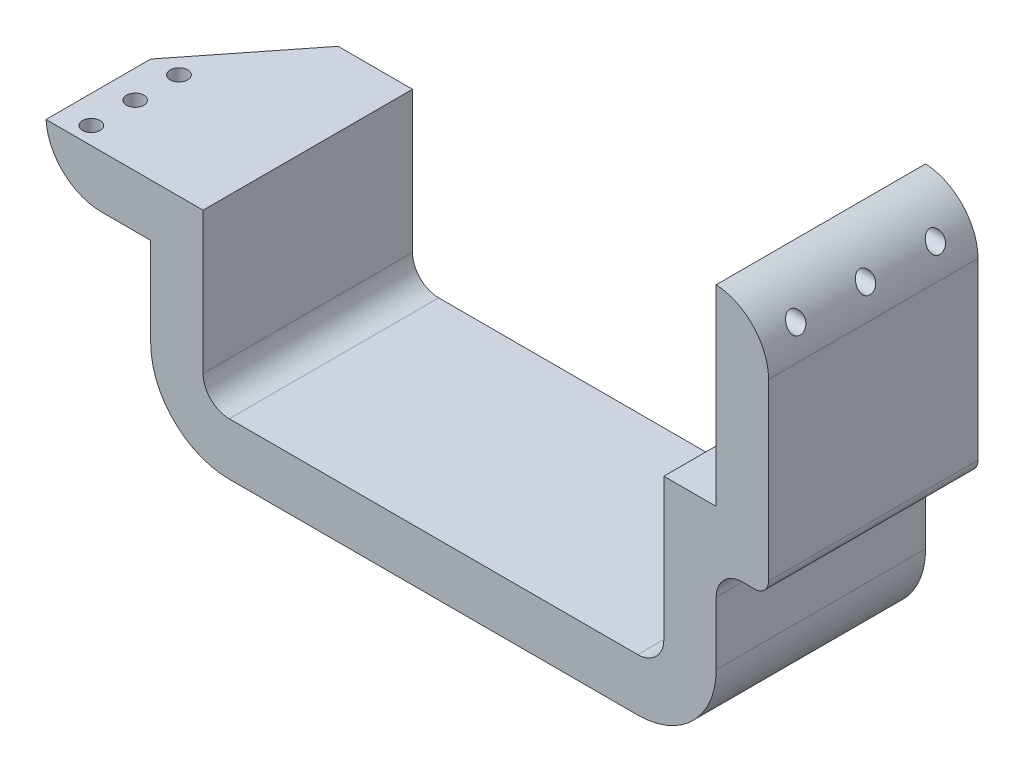
from build123d import *

# Parameters (mm, degrees)
BOSS_EXTRUDE1_DEPTH = 38.1
FILLET1_R           = 2.54
FILLET2_R           = 10.16
CUT_EXTRUDE2_DEPTH  = 91.653895256
SKETCH3_R           = 1.5875
CUT_EXTRUDE3_DEPTH  = 145.905274749
SKETCH4_R           = 1.5875
CUT_EXTRUDE4_DEPTH  = 91.653895347


with BuildPart() as part:
    # Sketch1 → Boss-Extrude1 (new body)
    with BuildSketch(Plane.XY):
        with BuildLine():
            Line((-35.8775, -27.305), (38.4175, -27.305))
            ThreePointArc((38.4175, -27.305), (48.520288136, -23.120288136), (52.705, -13.0175))
            Line((52.705, -13.0175), (52.705, -1.5875))
            ThreePointArc((52.705, -1.5875), (54.099903955, 1.780096045), (57.4675, 3.175))
            Line((57.4675, 3.175), (62.23, 3.175))
            Line((62.23, 3.175), (62.23, 47.625))
            Line((62.23, 47.625), (52.705, 47.625))
            Line((52.705, 47.625), (52.705, 12.7))
            Line((52.705, 12.7), (43.18, 12.7))
            Line((43.18, 12.7), (43.18, -13.0175))
            ThreePointArc((43.18, -13.0175), (41.785096045, -16.385096045), (38.4175, -17.78))
            Line((38.4175, -17.78), (-35.8775, -17.78))
            ThreePointArc((-35.8775, -17.78), (-39.245096045, -16.385096045), (-40.64, -13.0175))
            Line((-40.64, -13.0175), (-40.64, 12.7))
            Line((-40.64, 12.7), (-50.165, 12.7))
            Line((-50.165, 12.7), (-59.69, 12.7))
            Line((-59.69, 12.7), (-69.215, 12.7))
            Line((-69.215, 12.7), (-69.215, 3.175))
            Line((-69.215, 3.175), (-50.165, 3.175))
            Line((-50.165, 3.175), (-50.165, -13.0175))
            ThreePointArc((-50.165, -13.0175), (-45.980288136, -23.120288136), (-35.8775, -27.305))
        make_face()
    extrude(amount=BOSS_EXTRUDE1_DEPTH)

    # Fillet1
    fillet1_edges = [part.edges().sort_by_distance(p)[0] for p in [
        (62.23, 3.175, 19.05),
    ]]
    fillet(fillet1_edges, radius=FILLET1_R)

    # Fillet2
    # the kernel refuses this fillet: 10.16 mm, written as the material it takes off along each edge
    with BuildSketch(Plane(origin=(-69.215, 3.175, -25.350342083), x_dir=(1, 0, 0), z_dir=(0, 0, 1))) as fillet2_piece_1:
        with BuildLine():
            CenterArc((10.140136833, 10.16), FILLET2_R, 183.583321698, 86.416678302)
            Line((0, 9.525), (-0.202802737, 9.5123))
            ThreePointArc((-0.202802737, 9.5123), (-0.2032, 4.7625), (-0.2032, 0))
            Line((-0.2032, 0), (0, -0.2032))
            Line((0, -0.2032), (10.140136833, -0.2032))
            Line((10.140136833, -0.2032), (10.140136833, 0))
        make_face()
    extrude(amount=88.800684167, mode=Mode.SUBTRACT)
    with BuildSketch(Plane(origin=(62.23, 47.625, -25.350342083), x_dir=(0, -1, 0), z_dir=(0, 0, 1))) as fillet2_piece_2:
        with BuildLine():
            CenterArc((10.140136833, -10.16), FILLET2_R, 90, 86.416678302)
            Line((0, -9.525), (-0.202802737, -9.5123))
            ThreePointArc((-0.202802737, -9.5123), (-0.2032, -4.7625), (-0.2032, 0))
            Line((-0.2032, 0), (0, 0.2032))
            Line((0, 0.2032), (10.140136833, 0.2032))
            Line((10.140136833, 0.2032), (10.140136833, 0))
        make_face()
    extrude(amount=88.800684167, mode=Mode.SUBTRACT)

    # Sketch2 → Cut-Extrude2 (cut, through all)
    with BuildSketch(Plane.XZ.offset(-3.175)):
        Polygon((-69.215, -5.08), (-50.165, -5.08), (-69.215, 19.05), align=None)
    extrude(amount=-CUT_EXTRUDE2_DEPTH, mode=Mode.SUBTRACT)

    # Sketch3 → Cut-Extrude3 (cut, through all)
    with BuildSketch(Plane(origin=(62.23, 0, 0), x_dir=(0, 0, -1), z_dir=(1, 0, 0))):
        with Locations((-6.35, 42.554931583)):
            Circle(SKETCH3_R)
        with Locations((-19.05, 42.554931583)):
            Circle(SKETCH3_R)
        with Locations((-31.75, 42.554931583)):
            Circle(SKETCH3_R)
    extrude(amount=-CUT_EXTRUDE3_DEPTH, mode=Mode.SUBTRACT)

    # Sketch4 → Cut-Extrude4 (cut, through all)
    with BuildSketch(Plane.XZ.offset(-3.175)):
        with Locations((-64.144931583, 34.925)):
            Circle(SKETCH4_R)
        with Locations((-64.144931583, 26.951456669)):
            Circle(SKETCH4_R)
        with Locations((-64.144931583, 18.977913339)):
            Circle(SKETCH4_R)
    extrude(amount=-CUT_EXTRUDE4_DEPTH, mode=Mode.SUBTRACT)


solid = part.part
